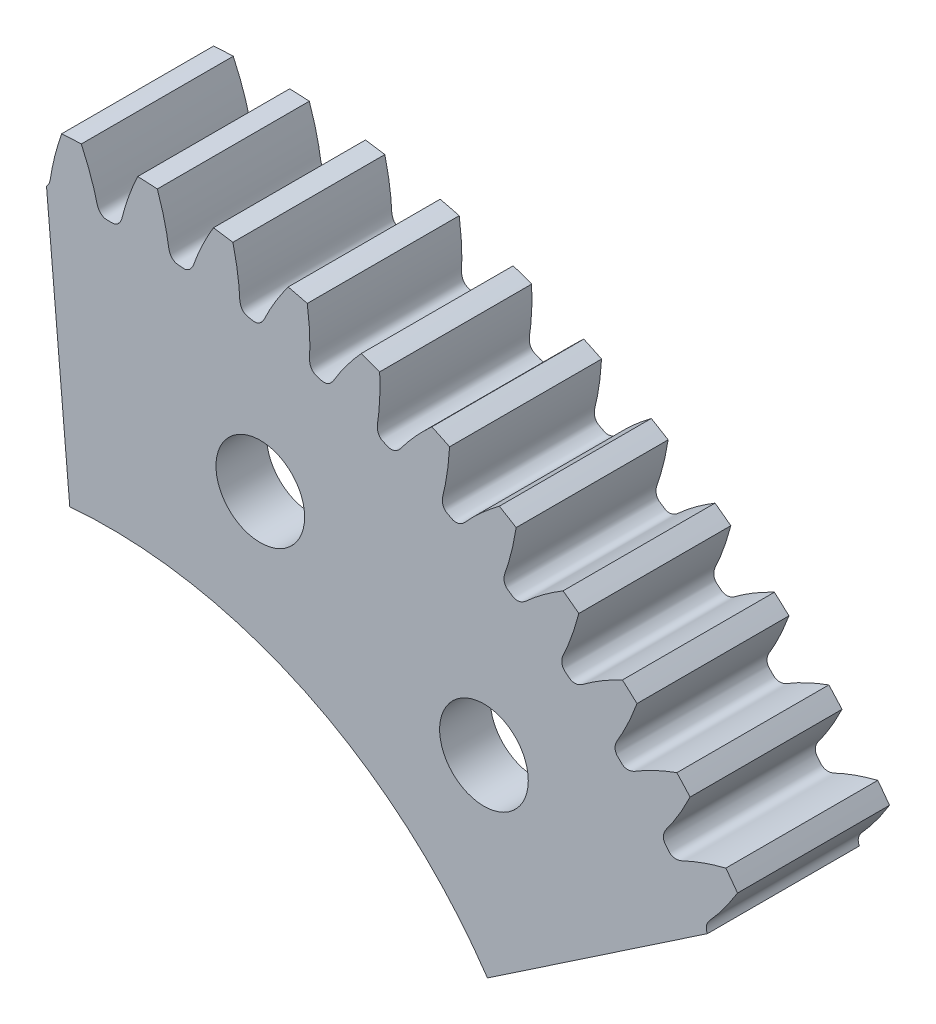
from build123d import *

# Parameters (mm, degrees)
SKETCHREVOLVESPURASSEMBLYNEW1GEAR_W       = 6
SKETCHREVOLVESPURASSEMBLYNEW1GEAR_H       = 30.5859375
TOOTHEXTRUDECUTSPURASSEMBLYNEW1GEAR_DEPTH = 4
PATTERNSPURASSEMBLYNEW1GEAR_COUNT         = 64
SKETCH_1_R                                = 1.75
CUT_EXTRUDE_1_DEPTH                       = 44.640806331
SKETCH_2_R                                = 26.5
CUT_EXTRUDE_2_DEPTH                       = 4


with BuildPart() as part:
    # SketchRevolveSpurAssemblyNew1Gear → SpurAssemblyNew1Gear (revolve)
    with BuildSketch(Plane(origin=(0, 0, 0), x_dir=(0, 0, -1), z_dir=(1, 0, 0))):
        with Locations((-1, 15.29296875)):
            Rectangle(SKETCHREVOLVESPURASSEMBLYNEW1GEAR_W, SKETCHREVOLVESPURASSEMBLYNEW1GEAR_H)
    revolve(axis=Axis((0, 0, 0), (0, 0, -1)))

    # SketchToothSpurAssemblyNew1Gear → ToothExtrudeCutSpurAssemblyNew1Gear (cut, symmetric)
    with BuildSketch(Plane.XY):
        with BuildLine():
            ThreePointArc((30.594491129, 1.126804494), (30.615234375, 0), (30.594491129, -1.126804494))
            add(Edge.make_bspline(
                [(30.594491129, -1.126804494), (30.513153248, -1.08876469), (30.392229292, -1.033862439), (30.232059487, -0.964523298), (30.116582931, -0.916114411), (30.004066749, -0.870473087), (29.894559131, -0.82752397), (29.788106911, -0.787190952), (29.68475557, -0.749397187), (29.584549189, -0.714065215), (29.487530555, -0.681116604), (29.393740749, -0.650473314), (29.303220551, -0.62205298), (29.216005463, -0.595785619), (29.132143126, -0.571555086), (29.051632325, -0.54940409), (28.953014436, -0.523038193), (28.872991777, -0.504974278), (28.812904254, -0.486133125), (28.791326421, -0.478779456), (28.770140086, -0.470929703), (28.749294691, -0.462524821), (28.728733016, -0.453489475), (28.708392896, -0.443727817), (28.68820819, -0.433118056), (28.668111681, -0.421505822), (28.648040322, -0.408696301), (28.627944409, -0.394445536), (28.607802663, -0.378452075), (28.587645794, -0.360351626), (28.567591022, -0.339719861), (28.547888439, -0.31609213), (28.528974517, -0.28901227), (28.511518918, -0.258123977), (28.496429245, -0.223305066), (28.484793836, -0.184833774), (28.478017662, -0.145607099), (28.474929153, -0.083645735), (28.477779142, 0), (28.474929153, 0.083645735), (28.478017662, 0.145607099), (28.484793836, 0.184833774), (28.496429245, 0.223305066), (28.511518918, 0.258123977), (28.528974517, 0.28901227), (28.547888439, 0.31609213), (28.567591022, 0.339719861), (28.587645794, 0.360351626), (28.607802663, 0.378452075), (28.627944409, 0.394445536), (28.648040322, 0.408696301), (28.668111681, 0.421505822), (28.68820819, 0.433118056), (28.708392896, 0.443727817), (28.728733016, 0.453489475), (28.749294691, 0.462524821), (28.770140086, 0.470929703), (28.791326421, 0.478779456), (28.812904254, 0.486133125), (28.872991777, 0.504974278), (28.953014436, 0.523038193), (29.051632325, 0.54940409), (29.132143126, 0.571555086), (29.216005463, 0.595785619), (29.303220551, 0.62205298), (29.393740749, 0.650473314), (29.487530555, 0.681116604), (29.584549189, 0.714065215), (29.68475557, 0.749397187), (29.788106911, 0.787190952), (29.894559131, 0.82752397), (30.004066749, 0.870473087), (30.116582931, 0.916114411), (30.232059487, 0.964523298), (30.392229292, 1.033862439), (30.513153248, 1.08876469), (30.594491129, 1.126804494)],
                knots=[0, 0, 0, 0, 0.052869434, 0.078187828, 0.102762008, 0.126591972, 0.149677722, 0.172019257, 0.193616576, 0.214469681, 0.234578571, 0.253943246, 0.272563705, 0.29043995, 0.30757198, 0.323959795, 0.339603395, 0.36768142, 0.372205404, 0.376674404, 0.381102619, 0.385506692, 0.389906194, 0.394324187, 0.398787872, 0.403329308, 0.407986154, 0.412802328, 0.417828375, 0.423121184, 0.428742439, 0.434754921, 0.441215584, 0.448164507, 0.455610022, 0.463512883, 0.471775764, 0.478976419, 0.5, 0.521023581, 0.528224236, 0.536487117, 0.544389978, 0.551835493, 0.558784416, 0.565245079, 0.571257561, 0.576878816, 0.582171625, 0.587197672, 0.592013846, 0.596670692, 0.601212128, 0.605675813, 0.610093806, 0.614493308, 0.618897381, 0.623325596, 0.627794596, 0.63231858, 0.660396605, 0.676040205, 0.69242802, 0.70956005, 0.727436295, 0.746056754, 0.765421429, 0.785530319, 0.806383424, 0.827980743, 0.850322278, 0.873408028, 0.897237992, 0.921812172, 0.947130566, 1, 1, 1, 1], degree=3))
        make_face()
    toothextrudecutspurassemblynew1gear = extrude(amount=TOOTHEXTRUDECUTSPURASSEMBLYNEW1GEAR_DEPTH, both=True, mode=Mode.SUBTRACT)

    # PatternSpurAssemblyNew1Gear: ToothExtrudeCutSpurAssemblyNew1Gear ×64 about axis
    patternspurassemblynew1gear_axis = Axis((0, 0, 50), (0, 0, -1))
    for i in range(1, PATTERNSPURASSEMBLYNEW1GEAR_COUNT):
        add(toothextrudecutspurassemblynew1gear.rotate(patternspurassemblynew1gear_axis, i * 360 / PATTERNSPURASSEMBLYNEW1GEAR_COUNT), mode=Mode.SUBTRACT)

    # Эскиз1 → Вырез-Вытянуть1 (cut, through all)
    with BuildSketch(Plane.XY.offset(4)):
        with Locations((5.952838037, 22.216294005)):
            Circle(SKETCH_1_R)
        with Locations((14.784115023, 17.619022192)):
            Circle(SKETCH_1_R)
        with BuildLine():
            Line((-1.568803369, 17.931504566), (-3.333811976, 38.105645253))
            ThreePointArc((-3.333811976, 38.105645253), (-16.467567197, -34.5249726), (31.711684173, 21.389801058))
            Line((31.711684173, 21.389801058), (14.922676306, 10.065472262))
            ThreePointArc((14.922676306, 10.065472262), (7.749199743, 16.246535118), (-1.568803369, 17.931504566))
        make_face()
    extrude(amount=-CUT_EXTRUDE_1_DEPTH, mode=Mode.SUBTRACT)

    # Эскиз2 → Вырез-Вытянуть2 (cut)
    with BuildSketch(Plane.XY.offset(-2)):
        Circle(SKETCH_2_R)
    extrude(amount=CUT_EXTRUDE_2_DEPTH, mode=Mode.SUBTRACT)


solid = part.part
